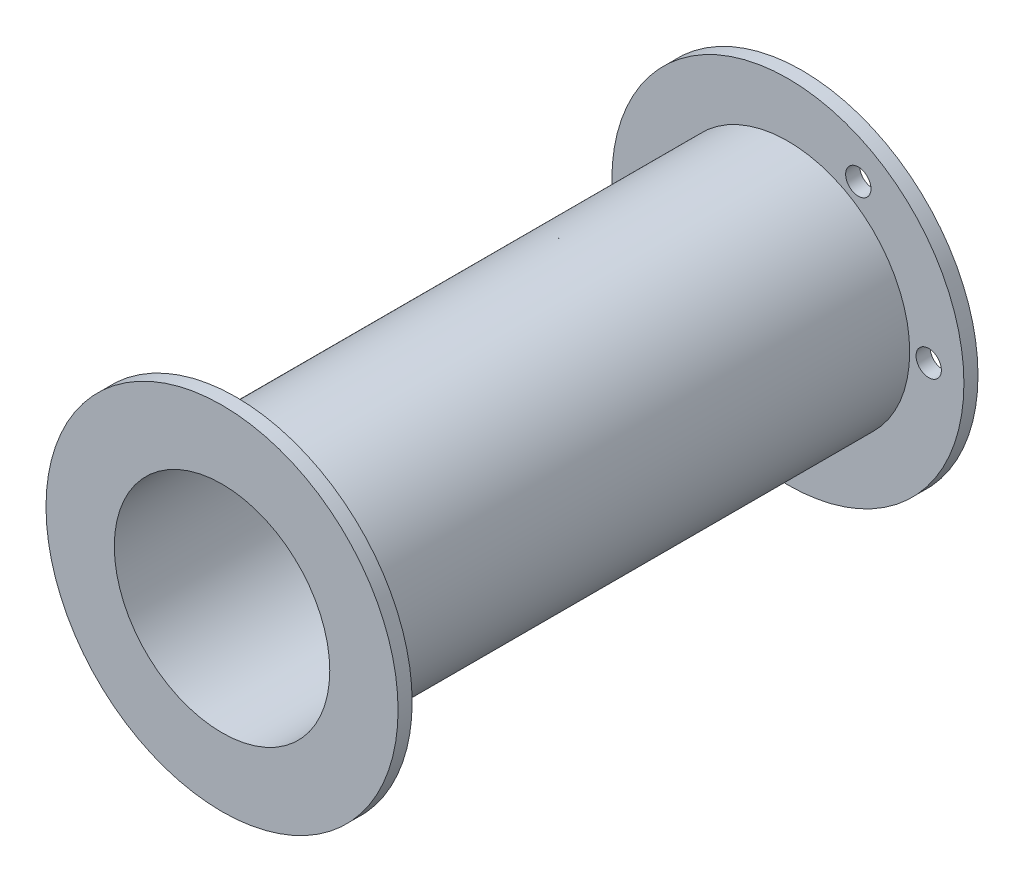
from build123d import *
from build123d.topology import SkipClean

# Parameters (mm, degrees)
SKETCH1_R           = 8.65
SKETCH1_R_2         = 7.65
BOSS_EXTRUDE1_DEPTH = 40.18
BOSS_EXTRUDE2_START = 1
SKETCH2_R           = 12.5
SKETCH2_R_2         = 7.65
BOSS_EXTRUDE2_DEPTH = 1
CIRPATTERN1_COUNT   = 6


with BuildPart() as part:
    # Sketch1 → Boss-Extrude1 (new body)
    with BuildSketch(Plane.XY):
        Circle(SKETCH1_R)
        Circle(SKETCH1_R_2, mode=Mode.SUBTRACT)
    extrude(amount=BOSS_EXTRUDE1_DEPTH)

    # Sketch2 → Boss-Extrude2 (add)
    with SkipClean():  # the faces are left unmerged after this step: merging them gives an invalid solid
        with BuildSketch(Plane(origin=(0, 0, 0), x_dir=(-1, 0, 0), z_dir=(0, 0, -1)).offset(BOSS_EXTRUDE2_START)):
            Circle(SKETCH2_R)
            Circle(SKETCH2_R_2, mode=Mode.SUBTRACT)
        boss_extrude2 = extrude(amount=-BOSS_EXTRUDE2_DEPTH)

    # Sketch11 → M1.6 Clearance Hole1 (revolve, cut)
    with SkipClean():  # the faces are left unmerged after this step: merging them gives an invalid solid
        with BuildSketch(Plane(origin=(-10, 0, 0), x_dir=(0, -1, 0), z_dir=(1, 0, 0))):
            Polygon((0, 0), (0, 5.540774557), (0.9, 5), (0.9, 0), align=None)
        m1_6_clearance_hole1 = revolve(axis=Axis((-10, 0, 6.35), (0, 0, -1)), mode=Mode.SUBTRACT)

    # CirPattern1: M1.6 Clearance Hole1 ×6 about axis, 2 skipped
    with SkipClean():  # the faces are left unmerged after this step: merging them gives an invalid solid
        cirpattern1_axis = Axis((0, 0, 0), (0, 0, -1))
        add([m1_6_clearance_hole1.rotate(cirpattern1_axis, i * 360 / CIRPATTERN1_COUNT) for i in range(1, CIRPATTERN1_COUNT) if i not in (1, 4)], mode=Mode.SUBTRACT)

    # Mirror1: Boss-Extrude2 across plane
    with SkipClean():  # the faces are left unmerged after this step: merging them gives an invalid solid
        add(boss_extrude2.mirror(Plane.XY.offset(19.59)))
    add(part.part.scale(1), mode=Mode.REPLACE)  # the faces are merged on a copy


solid = part.part
